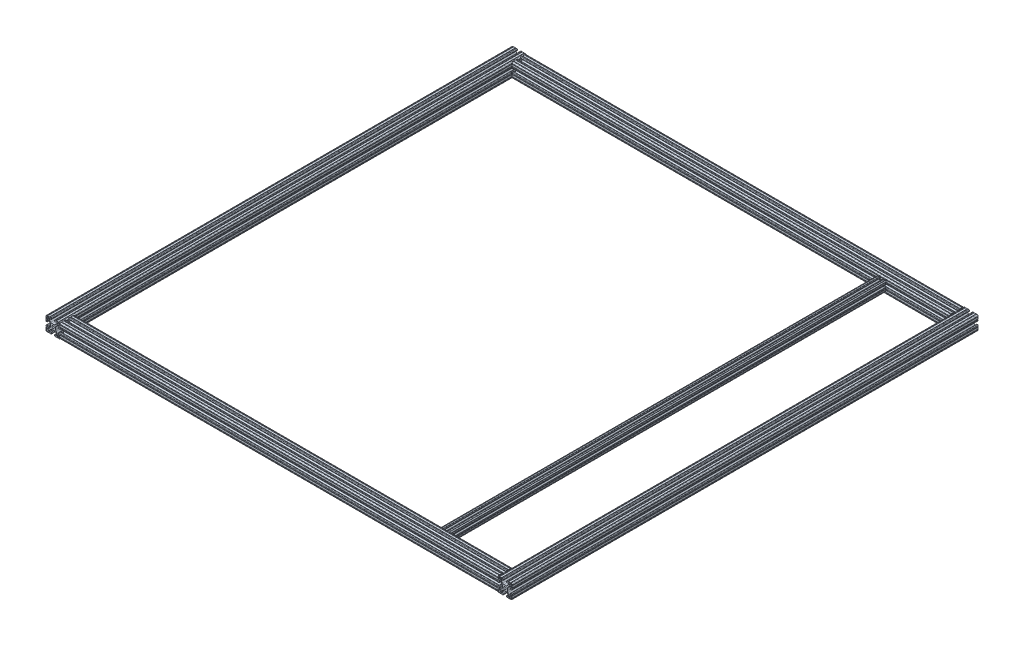
from build123d import *

# Parameters (mm, degrees)
STRUCTURAL_MEMBER1_DEPTH      = 1238.25
STRUCTURAL_MEMBER1_DEPTH_BACK = 19.05
SKETCH111_R                   = 3.3274
SKETCH111_ON_SEGMENT_2_R      = 3.3274
STRUCTURAL_MEMBER1_2_DEPTH    = 1257.3
SKETCH111_ON_SEGMENT_3_R      = 3.3274
STRUCTURAL_MEMBER1_3_DEPTH    = 1221.2
SKETCH111_ON_SEGMENT_4_R      = 3.3274
STRUCTURAL_MEMBER1_4_DEPTH    = 1221.2
SKETCH1_R                     = 2.6035
STRUCTURAL_MEMBER2_DEPTH      = 1219.2


with BuildPart() as part:
    # Sketch111 → Structural Member1 (new, two sides: drawn at the far end of the back side and taken through both)
    with BuildSketch(Plane(origin=(-609.6, 0, -609.6), x_dir=(1, 0, 0), z_dir=(0, 0, 1)).offset(-STRUCTURAL_MEMBER1_DEPTH_BACK)):
        with BuildLine():
            Line((-14.986, 6.858), (-15.8242, 6.858))
            Line((-15.8242, 6.858), (-15.8242, 9.017))
            ThreePointArc((-15.8242, 9.017), (-15.452225612, 9.915025612), (-14.5542, 10.287))
            Line((-14.5542, 10.287), (-12.810497326, 10.287))
            ThreePointArc((-12.810497326, 10.287), (-12.470291755, 10.219328904), (-12.181879398, 10.026617928))
            Line((-12.181879398, 10.026617928), (-8.249184211, 6.093922742))
            ThreePointArc((-8.249184211, 6.093922742), (-7.219556996, 4.552976719), (-6.858, 2.735306952))
            Line((-6.858, 2.735306952), (-6.858, -2.735306952))
            ThreePointArc((-6.858, -2.735306952), (-7.219556996, -4.552976719), (-8.249184211, -6.093922742))
            Line((-8.249184211, -6.093922742), (-12.181879398, -10.026617928))
            ThreePointArc((-12.181879398, -10.026617928), (-12.470291755, -10.219328904), (-12.810497326, -10.287))
            Line((-12.810497326, -10.287), (-14.5542, -10.287))
            ThreePointArc((-14.5542, -10.287), (-15.452225612, -9.915025612), (-15.8242, -9.017))
            Line((-15.8242, -9.017), (-15.8242, -6.858))
            Line((-15.8242, -6.858), (-14.986, -6.858))
            Line((-14.986, -6.858), (-14.986, -5.6388))
            ThreePointArc((-14.986, -5.6388), (-15.447248241, -4.525248241), (-16.5608, -4.064))
            Line((-16.5608, -4.064), (-17.4752, -4.064))
            ThreePointArc((-17.4752, -4.064), (-18.588751759, -4.525248241), (-19.05, -5.6388))
            Line((-19.05, -5.6388), (-19.05, -7.9756))
            ThreePointArc((-19.05, -7.9756), (-18.288, -8.7376), (-19.05, -9.4996))
            Line((-19.05, -9.4996), (-19.05, -14.3256))
            ThreePointArc((-19.05, -14.3256), (-18.288, -15.0876), (-19.05, -15.8496))
            Line((-19.05, -15.8496), (-19.05, -16.256))
            ThreePointArc((-19.05, -16.256), (-18.231656347, -18.231656347), (-16.256, -19.05))
            Line((-16.256, -19.05), (-15.8496, -19.05))
            ThreePointArc((-15.8496, -19.05), (-15.0876, -18.288), (-14.3256, -19.05))
            Line((-14.3256, -19.05), (-9.4996, -19.05))
            ThreePointArc((-9.4996, -19.05), (-8.7376, -18.288), (-7.9756, -19.05))
            Line((-7.9756, -19.05), (-5.6388, -19.05))
            ThreePointArc((-5.6388, -19.05), (-4.525248241, -18.588751759), (-4.064, -17.4752))
            Line((-4.064, -17.4752), (-4.064, -16.5608))
            ThreePointArc((-4.064, -16.5608), (-4.525248241, -15.447248241), (-5.6388, -14.986))
            Line((-5.6388, -14.986), (-6.858, -14.986))
            Line((-6.858, -14.986), (-6.858, -15.8242))
            Line((-6.858, -15.8242), (-9.017, -15.8242))
            ThreePointArc((-9.017, -15.8242), (-9.915025612, -15.452225612), (-10.287, -14.5542))
            Line((-10.287, -14.5542), (-10.287, -12.810497326))
            ThreePointArc((-10.287, -12.810497326), (-10.219328904, -12.470291755), (-10.026617928, -12.181879398))
            Line((-10.026617928, -12.181879398), (-6.093922742, -8.249184211))
            ThreePointArc((-6.093922742, -8.249184211), (-4.552976719, -7.219556996), (-2.735306952, -6.858))
            Line((-2.735306952, -6.858), (2.735306952, -6.858))
            ThreePointArc((2.735306952, -6.858), (4.552976719, -7.219556996), (6.093922742, -8.249184211))
            Line((6.093922742, -8.249184211), (10.026617928, -12.181879398))
            ThreePointArc((10.026617928, -12.181879398), (10.219328904, -12.470291755), (10.287, -12.810497326))
            Line((10.287, -12.810497326), (10.287, -14.5542))
            ThreePointArc((10.287, -14.5542), (9.915025612, -15.452225612), (9.017, -15.8242))
            Line((9.017, -15.8242), (6.858, -15.8242))
            Line((6.858, -15.8242), (6.858, -14.986))
            Line((6.858, -14.986), (5.6388, -14.986))
            ThreePointArc((5.6388, -14.986), (4.525248241, -15.447248241), (4.064, -16.5608))
            Line((4.064, -16.5608), (4.064, -17.4752))
            ThreePointArc((4.064, -17.4752), (4.525248241, -18.588751759), (5.6388, -19.05))
            Line((5.6388, -19.05), (7.9756, -19.05))
            ThreePointArc((7.9756, -19.05), (8.7376, -18.288), (9.4996, -19.05))
            Line((9.4996, -19.05), (14.3256, -19.05))
            ThreePointArc((14.3256, -19.05), (15.0876, -18.288), (15.8496, -19.05))
            Line((15.8496, -19.05), (16.256, -19.05))
            ThreePointArc((16.256, -19.05), (18.231656347, -18.231656347), (19.05, -16.256))
            Line((19.05, -16.256), (19.05, -15.8496))
            ThreePointArc((19.05, -15.8496), (18.288, -15.0876), (19.05, -14.3256))
            Line((19.05, -14.3256), (19.05, -9.4996))
            ThreePointArc((19.05, -9.4996), (18.288, -8.7376), (19.05, -7.9756))
            Line((19.05, -7.9756), (19.05, -5.6388))
            ThreePointArc((19.05, -5.6388), (18.588751759, -4.525248241), (17.4752, -4.064))
            Line((17.4752, -4.064), (16.5608, -4.064))
            ThreePointArc((16.5608, -4.064), (15.447248241, -4.525248241), (14.986, -5.6388))
            Line((14.986, -5.6388), (14.986, -6.858))
            Line((14.986, -6.858), (15.8242, -6.858))
            Line((15.8242, -6.858), (15.8242, -9.017))
            ThreePointArc((15.8242, -9.017), (15.452225612, -9.915025612), (14.5542, -10.287))
            Line((14.5542, -10.287), (12.810497326, -10.287))
            ThreePointArc((12.810497326, -10.287), (12.470291755, -10.219328904), (12.181879398, -10.026617928))
            Line((12.181879398, -10.026617928), (8.249184211, -6.093922742))
            ThreePointArc((8.249184211, -6.093922742), (7.219556996, -4.552976719), (6.858, -2.735306952))
            Line((6.858, -2.735306952), (6.858, 2.735306952))
            ThreePointArc((6.858, 2.735306952), (7.219556996, 4.552976719), (8.249184211, 6.093922742))
            Line((8.249184211, 6.093922742), (12.181879398, 10.026617928))
            ThreePointArc((12.181879398, 10.026617928), (12.470291755, 10.219328904), (12.810497326, 10.287))
            Line((12.810497326, 10.287), (14.5542, 10.287))
            ThreePointArc((14.5542, 10.287), (15.452225612, 9.915025612), (15.8242, 9.017))
            Line((15.8242, 9.017), (15.8242, 6.858))
            Line((15.8242, 6.858), (14.986, 6.858))
            Line((14.986, 6.858), (14.986, 5.6388))
            ThreePointArc((14.986, 5.6388), (15.447248241, 4.525248241), (16.5608, 4.064))
            Line((16.5608, 4.064), (17.4752, 4.064))
            ThreePointArc((17.4752, 4.064), (18.588751759, 4.525248241), (19.05, 5.6388))
            Line((19.05, 5.6388), (19.05, 7.9756))
            ThreePointArc((19.05, 7.9756), (18.288, 8.7376), (19.05, 9.4996))
            Line((19.05, 9.4996), (19.05, 14.3256))
            ThreePointArc((19.05, 14.3256), (18.288, 15.0876), (19.05, 15.8496))
            Line((19.05, 15.8496), (19.05, 16.256))
            ThreePointArc((19.05, 16.256), (18.231656347, 18.231656347), (16.256, 19.05))
            Line((16.256, 19.05), (15.8496, 19.05))
            ThreePointArc((15.8496, 19.05), (15.0876, 18.288), (14.3256, 19.05))
            Line((14.3256, 19.05), (9.4996, 19.05))
            ThreePointArc((9.4996, 19.05), (8.7376, 18.288), (7.9756, 19.05))
            Line((7.9756, 19.05), (5.6388, 19.05))
            ThreePointArc((5.6388, 19.05), (4.525248241, 18.588751759), (4.064, 17.4752))
            Line((4.064, 17.4752), (4.064, 16.5608))
            ThreePointArc((4.064, 16.5608), (4.525248241, 15.447248241), (5.6388, 14.986))
            Line((5.6388, 14.986), (6.858, 14.986))
            Line((6.858, 14.986), (6.858, 15.8242))
            Line((6.858, 15.8242), (9.017, 15.8242))
            ThreePointArc((9.017, 15.8242), (9.915025612, 15.452225612), (10.287, 14.5542))
            Line((10.287, 14.5542), (10.287, 12.810497326))
            ThreePointArc((10.287, 12.810497326), (10.219328904, 12.470291755), (10.026617928, 12.181879398))
            Line((10.026617928, 12.181879398), (6.093922742, 8.249184211))
            ThreePointArc((6.093922742, 8.249184211), (4.552976719, 7.219556996), (2.735306952, 6.858))
            Line((2.735306952, 6.858), (-2.735306952, 6.858))
            ThreePointArc((-2.735306952, 6.858), (-4.552976719, 7.219556996), (-6.093922742, 8.249184211))
            Line((-6.093922742, 8.249184211), (-10.026617928, 12.181879398))
            ThreePointArc((-10.026617928, 12.181879398), (-10.219328904, 12.470291755), (-10.287, 12.810497326))
            Line((-10.287, 12.810497326), (-10.287, 14.5542))
            ThreePointArc((-10.287, 14.5542), (-9.915025612, 15.452225612), (-9.017, 15.8242))
            Line((-9.017, 15.8242), (-6.858, 15.8242))
            Line((-6.858, 15.8242), (-6.858, 14.986))
            Line((-6.858, 14.986), (-5.6388, 14.986))
            ThreePointArc((-5.6388, 14.986), (-4.525248241, 15.447248241), (-4.064, 16.5608))
            Line((-4.064, 16.5608), (-4.064, 17.4752))
            ThreePointArc((-4.064, 17.4752), (-4.525248241, 18.588751759), (-5.6388, 19.05))
            Line((-5.6388, 19.05), (-7.9756, 19.05))
            ThreePointArc((-7.9756, 19.05), (-8.7376, 18.288), (-9.4996, 19.05))
            Line((-9.4996, 19.05), (-14.3256, 19.05))
            ThreePointArc((-14.3256, 19.05), (-15.0876, 18.288), (-15.8496, 19.05))
            Line((-15.8496, 19.05), (-16.256, 19.05))
            ThreePointArc((-16.256, 19.05), (-18.231656347, 18.231656347), (-19.05, 16.256))
            Line((-19.05, 16.256), (-19.05, 15.8496))
            ThreePointArc((-19.05, 15.8496), (-18.288, 15.0876), (-19.05, 14.3256))
            Line((-19.05, 14.3256), (-19.05, 9.4996))
            ThreePointArc((-19.05, 9.4996), (-18.288, 8.7376), (-19.05, 7.9756))
            Line((-19.05, 7.9756), (-19.05, 5.6388))
            ThreePointArc((-19.05, 5.6388), (-18.588751759, 4.525248241), (-17.4752, 4.064))
            Line((-17.4752, 4.064), (-16.5608, 4.064))
            ThreePointArc((-16.5608, 4.064), (-15.447248241, 4.525248241), (-14.986, 5.6388))
            Line((-14.986, 5.6388), (-14.986, 6.858))
        make_face()
        Circle(SKETCH111_R, mode=Mode.SUBTRACT)
        with BuildLine():
            Line((-11.8618, 16.8656), (-11.8618, 12.2428))
            ThreePointArc((-11.8618, 12.2428), (-11.973392316, 11.973392316), (-12.2428, 11.8618))
            Line((-12.2428, 11.8618), (-16.8656, 11.8618))
            ThreePointArc((-16.8656, 11.8618), (-17.135007684, 11.973392316), (-17.2466, 12.2428))
            Line((-17.2466, 12.2428), (-17.2466, 14.4526))
            ThreePointArc((-17.2466, 14.4526), (-16.428256347, 16.428256347), (-14.4526, 17.2466))
            Line((-14.4526, 17.2466), (-12.2428, 17.2466))
            ThreePointArc((-12.2428, 17.2466), (-11.973392316, 17.135007684), (-11.8618, 16.8656))
        make_face(mode=Mode.SUBTRACT)
        with BuildLine():
            Line((-16.8656, -11.8618), (-12.2428, -11.8618))
            ThreePointArc((-12.2428, -11.8618), (-11.973392316, -11.973392316), (-11.8618, -12.2428))
            Line((-11.8618, -12.2428), (-11.8618, -16.8656))
            ThreePointArc((-11.8618, -16.8656), (-11.973392316, -17.135007684), (-12.2428, -17.2466))
            Line((-12.2428, -17.2466), (-14.4526, -17.2466))
            ThreePointArc((-14.4526, -17.2466), (-16.428256347, -16.428256347), (-17.2466, -14.4526))
            Line((-17.2466, -14.4526), (-17.2466, -12.2428))
            ThreePointArc((-17.2466, -12.2428), (-17.135007684, -11.973392316), (-16.8656, -11.8618))
        make_face(mode=Mode.SUBTRACT)
        with BuildLine():
            Line((11.8618, -16.8656), (11.8618, -12.2428))
            ThreePointArc((11.8618, -12.2428), (11.973392316, -11.973392316), (12.2428, -11.8618))
            Line((12.2428, -11.8618), (16.8656, -11.8618))
            ThreePointArc((16.8656, -11.8618), (17.135007684, -11.973392316), (17.2466, -12.2428))
            Line((17.2466, -12.2428), (17.2466, -14.4526))
            ThreePointArc((17.2466, -14.4526), (16.428256347, -16.428256347), (14.4526, -17.2466))
            Line((14.4526, -17.2466), (12.2428, -17.2466))
            ThreePointArc((12.2428, -17.2466), (11.973392316, -17.135007684), (11.8618, -16.8656))
        make_face(mode=Mode.SUBTRACT)
        with BuildLine():
            Line((11.8618, 12.2428), (11.8618, 16.8656))
            ThreePointArc((11.8618, 16.8656), (11.973392316, 17.135007684), (12.2428, 17.2466))
            Line((12.2428, 17.2466), (14.4526, 17.2466))
            ThreePointArc((14.4526, 17.2466), (16.428256347, 16.428256347), (17.2466, 14.4526))
            Line((17.2466, 14.4526), (17.2466, 12.2428))
            ThreePointArc((17.2466, 12.2428), (17.135007684, 11.973392316), (16.8656, 11.8618))
            Line((16.8656, 11.8618), (12.2428, 11.8618))
            ThreePointArc((12.2428, 11.8618), (11.973392316, 11.973392316), (11.8618, 12.2428))
        make_face(mode=Mode.SUBTRACT)
    extrude(amount=STRUCTURAL_MEMBER1_DEPTH + STRUCTURAL_MEMBER1_DEPTH_BACK)


with BuildPart() as body_2:
    # Sketch111 on segment 2 (carried to segment 2) → Structural Member1 2 (new body)
    with BuildSketch(Plane(origin=(609.6, 0, -628.65), x_dir=(1, 0, 0), z_dir=(0, 0, 1))):
        with BuildLine():
            Line((-14.986, 6.858), (-15.8242, 6.858))
            Line((-15.8242, 6.858), (-15.8242, 9.017))
            ThreePointArc((-15.8242, 9.017), (-15.452225612, 9.915025612), (-14.5542, 10.287))
            Line((-14.5542, 10.287), (-12.810497326, 10.287))
            ThreePointArc((-12.810497326, 10.287), (-12.470291755, 10.219328904), (-12.181879398, 10.026617928))
            Line((-12.181879398, 10.026617928), (-8.249184211, 6.093922742))
            ThreePointArc((-8.249184211, 6.093922742), (-7.219556996, 4.552976719), (-6.858, 2.735306952))
            Line((-6.858, 2.735306952), (-6.858, -2.735306952))
            ThreePointArc((-6.858, -2.735306952), (-7.219556996, -4.552976719), (-8.249184211, -6.093922742))
            Line((-8.249184211, -6.093922742), (-12.181879398, -10.026617928))
            ThreePointArc((-12.181879398, -10.026617928), (-12.470291755, -10.219328904), (-12.810497326, -10.287))
            Line((-12.810497326, -10.287), (-14.5542, -10.287))
            ThreePointArc((-14.5542, -10.287), (-15.452225612, -9.915025612), (-15.8242, -9.017))
            Line((-15.8242, -9.017), (-15.8242, -6.858))
            Line((-15.8242, -6.858), (-14.986, -6.858))
            Line((-14.986, -6.858), (-14.986, -5.6388))
            ThreePointArc((-14.986, -5.6388), (-15.447248241, -4.525248241), (-16.5608, -4.064))
            Line((-16.5608, -4.064), (-17.4752, -4.064))
            ThreePointArc((-17.4752, -4.064), (-18.588751759, -4.525248241), (-19.05, -5.6388))
            Line((-19.05, -5.6388), (-19.05, -7.9756))
            ThreePointArc((-19.05, -7.9756), (-18.288, -8.7376), (-19.05, -9.4996))
            Line((-19.05, -9.4996), (-19.05, -14.3256))
            ThreePointArc((-19.05, -14.3256), (-18.288, -15.0876), (-19.05, -15.8496))
            Line((-19.05, -15.8496), (-19.05, -16.256))
            ThreePointArc((-19.05, -16.256), (-18.231656347, -18.231656347), (-16.256, -19.05))
            Line((-16.256, -19.05), (-15.8496, -19.05))
            ThreePointArc((-15.8496, -19.05), (-15.0876, -18.288), (-14.3256, -19.05))
            Line((-14.3256, -19.05), (-9.4996, -19.05))
            ThreePointArc((-9.4996, -19.05), (-8.7376, -18.288), (-7.9756, -19.05))
            Line((-7.9756, -19.05), (-5.6388, -19.05))
            ThreePointArc((-5.6388, -19.05), (-4.525248241, -18.588751759), (-4.064, -17.4752))
            Line((-4.064, -17.4752), (-4.064, -16.5608))
            ThreePointArc((-4.064, -16.5608), (-4.525248241, -15.447248241), (-5.6388, -14.986))
            Line((-5.6388, -14.986), (-6.858, -14.986))
            Line((-6.858, -14.986), (-6.858, -15.8242))
            Line((-6.858, -15.8242), (-9.017, -15.8242))
            ThreePointArc((-9.017, -15.8242), (-9.915025612, -15.452225612), (-10.287, -14.5542))
            Line((-10.287, -14.5542), (-10.287, -12.810497326))
            ThreePointArc((-10.287, -12.810497326), (-10.219328904, -12.470291755), (-10.026617928, -12.181879398))
            Line((-10.026617928, -12.181879398), (-6.093922742, -8.249184211))
            ThreePointArc((-6.093922742, -8.249184211), (-4.552976719, -7.219556996), (-2.735306952, -6.858))
            Line((-2.735306952, -6.858), (2.735306952, -6.858))
            ThreePointArc((2.735306952, -6.858), (4.552976719, -7.219556996), (6.093922742, -8.249184211))
            Line((6.093922742, -8.249184211), (10.026617928, -12.181879398))
            ThreePointArc((10.026617928, -12.181879398), (10.219328904, -12.470291755), (10.287, -12.810497326))
            Line((10.287, -12.810497326), (10.287, -14.5542))
            ThreePointArc((10.287, -14.5542), (9.915025612, -15.452225612), (9.017, -15.8242))
            Line((9.017, -15.8242), (6.858, -15.8242))
            Line((6.858, -15.8242), (6.858, -14.986))
            Line((6.858, -14.986), (5.6388, -14.986))
            ThreePointArc((5.6388, -14.986), (4.525248241, -15.447248241), (4.064, -16.5608))
            Line((4.064, -16.5608), (4.064, -17.4752))
            ThreePointArc((4.064, -17.4752), (4.525248241, -18.588751759), (5.6388, -19.05))
            Line((5.6388, -19.05), (7.9756, -19.05))
            ThreePointArc((7.9756, -19.05), (8.7376, -18.288), (9.4996, -19.05))
            Line((9.4996, -19.05), (14.3256, -19.05))
            ThreePointArc((14.3256, -19.05), (15.0876, -18.288), (15.8496, -19.05))
            Line((15.8496, -19.05), (16.256, -19.05))
            ThreePointArc((16.256, -19.05), (18.231656347, -18.231656347), (19.05, -16.256))
            Line((19.05, -16.256), (19.05, -15.8496))
            ThreePointArc((19.05, -15.8496), (18.288, -15.0876), (19.05, -14.3256))
            Line((19.05, -14.3256), (19.05, -9.4996))
            ThreePointArc((19.05, -9.4996), (18.288, -8.7376), (19.05, -7.9756))
            Line((19.05, -7.9756), (19.05, -5.6388))
            ThreePointArc((19.05, -5.6388), (18.588751759, -4.525248241), (17.4752, -4.064))
            Line((17.4752, -4.064), (16.5608, -4.064))
            ThreePointArc((16.5608, -4.064), (15.447248241, -4.525248241), (14.986, -5.6388))
            Line((14.986, -5.6388), (14.986, -6.858))
            Line((14.986, -6.858), (15.8242, -6.858))
            Line((15.8242, -6.858), (15.8242, -9.017))
            ThreePointArc((15.8242, -9.017), (15.452225612, -9.915025612), (14.5542, -10.287))
            Line((14.5542, -10.287), (12.810497326, -10.287))
            ThreePointArc((12.810497326, -10.287), (12.470291755, -10.219328904), (12.181879398, -10.026617928))
            Line((12.181879398, -10.026617928), (8.249184211, -6.093922742))
            ThreePointArc((8.249184211, -6.093922742), (7.219556996, -4.552976719), (6.858, -2.735306952))
            Line((6.858, -2.735306952), (6.858, 2.735306952))
            ThreePointArc((6.858, 2.735306952), (7.219556996, 4.552976719), (8.249184211, 6.093922742))
            Line((8.249184211, 6.093922742), (12.181879398, 10.026617928))
            ThreePointArc((12.181879398, 10.026617928), (12.470291755, 10.219328904), (12.810497326, 10.287))
            Line((12.810497326, 10.287), (14.5542, 10.287))
            ThreePointArc((14.5542, 10.287), (15.452225612, 9.915025612), (15.8242, 9.017))
            Line((15.8242, 9.017), (15.8242, 6.858))
            Line((15.8242, 6.858), (14.986, 6.858))
            Line((14.986, 6.858), (14.986, 5.6388))
            ThreePointArc((14.986, 5.6388), (15.447248241, 4.525248241), (16.5608, 4.064))
            Line((16.5608, 4.064), (17.4752, 4.064))
            ThreePointArc((17.4752, 4.064), (18.588751759, 4.525248241), (19.05, 5.6388))
            Line((19.05, 5.6388), (19.05, 7.9756))
            ThreePointArc((19.05, 7.9756), (18.288, 8.7376), (19.05, 9.4996))
            Line((19.05, 9.4996), (19.05, 14.3256))
            ThreePointArc((19.05, 14.3256), (18.288, 15.0876), (19.05, 15.8496))
            Line((19.05, 15.8496), (19.05, 16.256))
            ThreePointArc((19.05, 16.256), (18.231656347, 18.231656347), (16.256, 19.05))
            Line((16.256, 19.05), (15.8496, 19.05))
            ThreePointArc((15.8496, 19.05), (15.0876, 18.288), (14.3256, 19.05))
            Line((14.3256, 19.05), (9.4996, 19.05))
            ThreePointArc((9.4996, 19.05), (8.7376, 18.288), (7.9756, 19.05))
            Line((7.9756, 19.05), (5.6388, 19.05))
            ThreePointArc((5.6388, 19.05), (4.525248241, 18.588751759), (4.064, 17.4752))
            Line((4.064, 17.4752), (4.064, 16.5608))
            ThreePointArc((4.064, 16.5608), (4.525248241, 15.447248241), (5.6388, 14.986))
            Line((5.6388, 14.986), (6.858, 14.986))
            Line((6.858, 14.986), (6.858, 15.8242))
            Line((6.858, 15.8242), (9.017, 15.8242))
            ThreePointArc((9.017, 15.8242), (9.915025612, 15.452225612), (10.287, 14.5542))
            Line((10.287, 14.5542), (10.287, 12.810497326))
            ThreePointArc((10.287, 12.810497326), (10.219328904, 12.470291755), (10.026617928, 12.181879398))
            Line((10.026617928, 12.181879398), (6.093922742, 8.249184211))
            ThreePointArc((6.093922742, 8.249184211), (4.552976719, 7.219556996), (2.735306952, 6.858))
            Line((2.735306952, 6.858), (-2.735306952, 6.858))
            ThreePointArc((-2.735306952, 6.858), (-4.552976719, 7.219556996), (-6.093922742, 8.249184211))
            Line((-6.093922742, 8.249184211), (-10.026617928, 12.181879398))
            ThreePointArc((-10.026617928, 12.181879398), (-10.219328904, 12.470291755), (-10.287, 12.810497326))
            Line((-10.287, 12.810497326), (-10.287, 14.5542))
            ThreePointArc((-10.287, 14.5542), (-9.915025612, 15.452225612), (-9.017, 15.8242))
            Line((-9.017, 15.8242), (-6.858, 15.8242))
            Line((-6.858, 15.8242), (-6.858, 14.986))
            Line((-6.858, 14.986), (-5.6388, 14.986))
            ThreePointArc((-5.6388, 14.986), (-4.525248241, 15.447248241), (-4.064, 16.5608))
            Line((-4.064, 16.5608), (-4.064, 17.4752))
            ThreePointArc((-4.064, 17.4752), (-4.525248241, 18.588751759), (-5.6388, 19.05))
            Line((-5.6388, 19.05), (-7.9756, 19.05))
            ThreePointArc((-7.9756, 19.05), (-8.7376, 18.288), (-9.4996, 19.05))
            Line((-9.4996, 19.05), (-14.3256, 19.05))
            ThreePointArc((-14.3256, 19.05), (-15.0876, 18.288), (-15.8496, 19.05))
            Line((-15.8496, 19.05), (-16.256, 19.05))
            ThreePointArc((-16.256, 19.05), (-18.231656347, 18.231656347), (-19.05, 16.256))
            Line((-19.05, 16.256), (-19.05, 15.8496))
            ThreePointArc((-19.05, 15.8496), (-18.288, 15.0876), (-19.05, 14.3256))
            Line((-19.05, 14.3256), (-19.05, 9.4996))
            ThreePointArc((-19.05, 9.4996), (-18.288, 8.7376), (-19.05, 7.9756))
            Line((-19.05, 7.9756), (-19.05, 5.6388))
            ThreePointArc((-19.05, 5.6388), (-18.588751759, 4.525248241), (-17.4752, 4.064))
            Line((-17.4752, 4.064), (-16.5608, 4.064))
            ThreePointArc((-16.5608, 4.064), (-15.447248241, 4.525248241), (-14.986, 5.6388))
            Line((-14.986, 5.6388), (-14.986, 6.858))
        make_face()
        Circle(SKETCH111_ON_SEGMENT_2_R, mode=Mode.SUBTRACT)
        with BuildLine():
            Line((-11.8618, 16.8656), (-11.8618, 12.2428))
            ThreePointArc((-11.8618, 12.2428), (-11.973392316, 11.973392316), (-12.2428, 11.8618))
            Line((-12.2428, 11.8618), (-16.8656, 11.8618))
            ThreePointArc((-16.8656, 11.8618), (-17.135007684, 11.973392316), (-17.2466, 12.2428))
            Line((-17.2466, 12.2428), (-17.2466, 14.4526))
            ThreePointArc((-17.2466, 14.4526), (-16.428256347, 16.428256347), (-14.4526, 17.2466))
            Line((-14.4526, 17.2466), (-12.2428, 17.2466))
            ThreePointArc((-12.2428, 17.2466), (-11.973392316, 17.135007684), (-11.8618, 16.8656))
        make_face(mode=Mode.SUBTRACT)
        with BuildLine():
            Line((-16.8656, -11.8618), (-12.2428, -11.8618))
            ThreePointArc((-12.2428, -11.8618), (-11.973392316, -11.973392316), (-11.8618, -12.2428))
            Line((-11.8618, -12.2428), (-11.8618, -16.8656))
            ThreePointArc((-11.8618, -16.8656), (-11.973392316, -17.135007684), (-12.2428, -17.2466))
            Line((-12.2428, -17.2466), (-14.4526, -17.2466))
            ThreePointArc((-14.4526, -17.2466), (-16.428256347, -16.428256347), (-17.2466, -14.4526))
            Line((-17.2466, -14.4526), (-17.2466, -12.2428))
            ThreePointArc((-17.2466, -12.2428), (-17.135007684, -11.973392316), (-16.8656, -11.8618))
        make_face(mode=Mode.SUBTRACT)
        with BuildLine():
            Line((11.8618, -16.8656), (11.8618, -12.2428))
            ThreePointArc((11.8618, -12.2428), (11.973392316, -11.973392316), (12.2428, -11.8618))
            Line((12.2428, -11.8618), (16.8656, -11.8618))
            ThreePointArc((16.8656, -11.8618), (17.135007684, -11.973392316), (17.2466, -12.2428))
            Line((17.2466, -12.2428), (17.2466, -14.4526))
            ThreePointArc((17.2466, -14.4526), (16.428256347, -16.428256347), (14.4526, -17.2466))
            Line((14.4526, -17.2466), (12.2428, -17.2466))
            ThreePointArc((12.2428, -17.2466), (11.973392316, -17.135007684), (11.8618, -16.8656))
        make_face(mode=Mode.SUBTRACT)
        with BuildLine():
            Line((11.8618, 12.2428), (11.8618, 16.8656))
            ThreePointArc((11.8618, 16.8656), (11.973392316, 17.135007684), (12.2428, 17.2466))
            Line((12.2428, 17.2466), (14.4526, 17.2466))
            ThreePointArc((14.4526, 17.2466), (16.428256347, 16.428256347), (17.2466, 14.4526))
            Line((17.2466, 14.4526), (17.2466, 12.2428))
            ThreePointArc((17.2466, 12.2428), (17.135007684, 11.973392316), (16.8656, 11.8618))
            Line((16.8656, 11.8618), (12.2428, 11.8618))
            ThreePointArc((12.2428, 11.8618), (11.973392316, 11.973392316), (11.8618, 12.2428))
        make_face(mode=Mode.SUBTRACT)
    extrude(amount=STRUCTURAL_MEMBER1_2_DEPTH)


with BuildPart() as body_3:
    # Sketch111 on segment 3 (carried to segment 3) → Structural Member1 3 (new body)
    with BuildSketch(Plane(origin=(-610.6, 0, 609.6), x_dir=(0, 0, -1), z_dir=(1, 0, 0))):
        with BuildLine():
            Line((-14.986, 6.858), (-15.8242, 6.858))
            Line((-15.8242, 6.858), (-15.8242, 9.017))
            ThreePointArc((-15.8242, 9.017), (-15.452225612, 9.915025612), (-14.5542, 10.287))
            Line((-14.5542, 10.287), (-12.810497326, 10.287))
            ThreePointArc((-12.810497326, 10.287), (-12.470291755, 10.219328904), (-12.181879398, 10.026617928))
            Line((-12.181879398, 10.026617928), (-8.249184211, 6.093922742))
            ThreePointArc((-8.249184211, 6.093922742), (-7.219556996, 4.552976719), (-6.858, 2.735306952))
            Line((-6.858, 2.735306952), (-6.858, -2.735306952))
            ThreePointArc((-6.858, -2.735306952), (-7.219556996, -4.552976719), (-8.249184211, -6.093922742))
            Line((-8.249184211, -6.093922742), (-12.181879398, -10.026617928))
            ThreePointArc((-12.181879398, -10.026617928), (-12.470291755, -10.219328904), (-12.810497326, -10.287))
            Line((-12.810497326, -10.287), (-14.5542, -10.287))
            ThreePointArc((-14.5542, -10.287), (-15.452225612, -9.915025612), (-15.8242, -9.017))
            Line((-15.8242, -9.017), (-15.8242, -6.858))
            Line((-15.8242, -6.858), (-14.986, -6.858))
            Line((-14.986, -6.858), (-14.986, -5.6388))
            ThreePointArc((-14.986, -5.6388), (-15.447248241, -4.525248241), (-16.5608, -4.064))
            Line((-16.5608, -4.064), (-17.4752, -4.064))
            ThreePointArc((-17.4752, -4.064), (-18.588751759, -4.525248241), (-19.05, -5.6388))
            Line((-19.05, -5.6388), (-19.05, -7.9756))
            ThreePointArc((-19.05, -7.9756), (-18.288, -8.7376), (-19.05, -9.4996))
            Line((-19.05, -9.4996), (-19.05, -14.3256))
            ThreePointArc((-19.05, -14.3256), (-18.288, -15.0876), (-19.05, -15.8496))
            Line((-19.05, -15.8496), (-19.05, -16.256))
            ThreePointArc((-19.05, -16.256), (-18.231656347, -18.231656347), (-16.256, -19.05))
            Line((-16.256, -19.05), (-15.8496, -19.05))
            ThreePointArc((-15.8496, -19.05), (-15.0876, -18.288), (-14.3256, -19.05))
            Line((-14.3256, -19.05), (-9.4996, -19.05))
            ThreePointArc((-9.4996, -19.05), (-8.7376, -18.288), (-7.9756, -19.05))
            Line((-7.9756, -19.05), (-5.6388, -19.05))
            ThreePointArc((-5.6388, -19.05), (-4.525248241, -18.588751759), (-4.064, -17.4752))
            Line((-4.064, -17.4752), (-4.064, -16.5608))
            ThreePointArc((-4.064, -16.5608), (-4.525248241, -15.447248241), (-5.6388, -14.986))
            Line((-5.6388, -14.986), (-6.858, -14.986))
            Line((-6.858, -14.986), (-6.858, -15.8242))
            Line((-6.858, -15.8242), (-9.017, -15.8242))
            ThreePointArc((-9.017, -15.8242), (-9.915025612, -15.452225612), (-10.287, -14.5542))
            Line((-10.287, -14.5542), (-10.287, -12.810497326))
            ThreePointArc((-10.287, -12.810497326), (-10.219328904, -12.470291755), (-10.026617928, -12.181879398))
            Line((-10.026617928, -12.181879398), (-6.093922742, -8.249184211))
            ThreePointArc((-6.093922742, -8.249184211), (-4.552976719, -7.219556996), (-2.735306952, -6.858))
            Line((-2.735306952, -6.858), (2.735306952, -6.858))
            ThreePointArc((2.735306952, -6.858), (4.552976719, -7.219556996), (6.093922742, -8.249184211))
            Line((6.093922742, -8.249184211), (10.026617928, -12.181879398))
            ThreePointArc((10.026617928, -12.181879398), (10.219328904, -12.470291755), (10.287, -12.810497326))
            Line((10.287, -12.810497326), (10.287, -14.5542))
            ThreePointArc((10.287, -14.5542), (9.915025612, -15.452225612), (9.017, -15.8242))
            Line((9.017, -15.8242), (6.858, -15.8242))
            Line((6.858, -15.8242), (6.858, -14.986))
            Line((6.858, -14.986), (5.6388, -14.986))
            ThreePointArc((5.6388, -14.986), (4.525248241, -15.447248241), (4.064, -16.5608))
            Line((4.064, -16.5608), (4.064, -17.4752))
            ThreePointArc((4.064, -17.4752), (4.525248241, -18.588751759), (5.6388, -19.05))
            Line((5.6388, -19.05), (7.9756, -19.05))
            ThreePointArc((7.9756, -19.05), (8.7376, -18.288), (9.4996, -19.05))
            Line((9.4996, -19.05), (14.3256, -19.05))
            ThreePointArc((14.3256, -19.05), (15.0876, -18.288), (15.8496, -19.05))
            Line((15.8496, -19.05), (16.256, -19.05))
            ThreePointArc((16.256, -19.05), (18.231656347, -18.231656347), (19.05, -16.256))
            Line((19.05, -16.256), (19.05, -15.8496))
            ThreePointArc((19.05, -15.8496), (18.288, -15.0876), (19.05, -14.3256))
            Line((19.05, -14.3256), (19.05, -9.4996))
            ThreePointArc((19.05, -9.4996), (18.288, -8.7376), (19.05, -7.9756))
            Line((19.05, -7.9756), (19.05, -5.6388))
            ThreePointArc((19.05, -5.6388), (18.588751759, -4.525248241), (17.4752, -4.064))
            Line((17.4752, -4.064), (16.5608, -4.064))
            ThreePointArc((16.5608, -4.064), (15.447248241, -4.525248241), (14.986, -5.6388))
            Line((14.986, -5.6388), (14.986, -6.858))
            Line((14.986, -6.858), (15.8242, -6.858))
            Line((15.8242, -6.858), (15.8242, -9.017))
            ThreePointArc((15.8242, -9.017), (15.452225612, -9.915025612), (14.5542, -10.287))
            Line((14.5542, -10.287), (12.810497326, -10.287))
            ThreePointArc((12.810497326, -10.287), (12.470291755, -10.219328904), (12.181879398, -10.026617928))
            Line((12.181879398, -10.026617928), (8.249184211, -6.093922742))
            ThreePointArc((8.249184211, -6.093922742), (7.219556996, -4.552976719), (6.858, -2.735306952))
            Line((6.858, -2.735306952), (6.858, 2.735306952))
            ThreePointArc((6.858, 2.735306952), (7.219556996, 4.552976719), (8.249184211, 6.093922742))
            Line((8.249184211, 6.093922742), (12.181879398, 10.026617928))
            ThreePointArc((12.181879398, 10.026617928), (12.470291755, 10.219328904), (12.810497326, 10.287))
            Line((12.810497326, 10.287), (14.5542, 10.287))
            ThreePointArc((14.5542, 10.287), (15.452225612, 9.915025612), (15.8242, 9.017))
            Line((15.8242, 9.017), (15.8242, 6.858))
            Line((15.8242, 6.858), (14.986, 6.858))
            Line((14.986, 6.858), (14.986, 5.6388))
            ThreePointArc((14.986, 5.6388), (15.447248241, 4.525248241), (16.5608, 4.064))
            Line((16.5608, 4.064), (17.4752, 4.064))
            ThreePointArc((17.4752, 4.064), (18.588751759, 4.525248241), (19.05, 5.6388))
            Line((19.05, 5.6388), (19.05, 7.9756))
            ThreePointArc((19.05, 7.9756), (18.288, 8.7376), (19.05, 9.4996))
            Line((19.05, 9.4996), (19.05, 14.3256))
            ThreePointArc((19.05, 14.3256), (18.288, 15.0876), (19.05, 15.8496))
            Line((19.05, 15.8496), (19.05, 16.256))
            ThreePointArc((19.05, 16.256), (18.231656347, 18.231656347), (16.256, 19.05))
            Line((16.256, 19.05), (15.8496, 19.05))
            ThreePointArc((15.8496, 19.05), (15.0876, 18.288), (14.3256, 19.05))
            Line((14.3256, 19.05), (9.4996, 19.05))
            ThreePointArc((9.4996, 19.05), (8.7376, 18.288), (7.9756, 19.05))
            Line((7.9756, 19.05), (5.6388, 19.05))
            ThreePointArc((5.6388, 19.05), (4.525248241, 18.588751759), (4.064, 17.4752))
            Line((4.064, 17.4752), (4.064, 16.5608))
            ThreePointArc((4.064, 16.5608), (4.525248241, 15.447248241), (5.6388, 14.986))
            Line((5.6388, 14.986), (6.858, 14.986))
            Line((6.858, 14.986), (6.858, 15.8242))
            Line((6.858, 15.8242), (9.017, 15.8242))
            ThreePointArc((9.017, 15.8242), (9.915025612, 15.452225612), (10.287, 14.5542))
            Line((10.287, 14.5542), (10.287, 12.810497326))
            ThreePointArc((10.287, 12.810497326), (10.219328904, 12.470291755), (10.026617928, 12.181879398))
            Line((10.026617928, 12.181879398), (6.093922742, 8.249184211))
            ThreePointArc((6.093922742, 8.249184211), (4.552976719, 7.219556996), (2.735306952, 6.858))
            Line((2.735306952, 6.858), (-2.735306952, 6.858))
            ThreePointArc((-2.735306952, 6.858), (-4.552976719, 7.219556996), (-6.093922742, 8.249184211))
            Line((-6.093922742, 8.249184211), (-10.026617928, 12.181879398))
            ThreePointArc((-10.026617928, 12.181879398), (-10.219328904, 12.470291755), (-10.287, 12.810497326))
            Line((-10.287, 12.810497326), (-10.287, 14.5542))
            ThreePointArc((-10.287, 14.5542), (-9.915025612, 15.452225612), (-9.017, 15.8242))
            Line((-9.017, 15.8242), (-6.858, 15.8242))
            Line((-6.858, 15.8242), (-6.858, 14.986))
            Line((-6.858, 14.986), (-5.6388, 14.986))
            ThreePointArc((-5.6388, 14.986), (-4.525248241, 15.447248241), (-4.064, 16.5608))
            Line((-4.064, 16.5608), (-4.064, 17.4752))
            ThreePointArc((-4.064, 17.4752), (-4.525248241, 18.588751759), (-5.6388, 19.05))
            Line((-5.6388, 19.05), (-7.9756, 19.05))
            ThreePointArc((-7.9756, 19.05), (-8.7376, 18.288), (-9.4996, 19.05))
            Line((-9.4996, 19.05), (-14.3256, 19.05))
            ThreePointArc((-14.3256, 19.05), (-15.0876, 18.288), (-15.8496, 19.05))
            Line((-15.8496, 19.05), (-16.256, 19.05))
            ThreePointArc((-16.256, 19.05), (-18.231656347, 18.231656347), (-19.05, 16.256))
            Line((-19.05, 16.256), (-19.05, 15.8496))
            ThreePointArc((-19.05, 15.8496), (-18.288, 15.0876), (-19.05, 14.3256))
            Line((-19.05, 14.3256), (-19.05, 9.4996))
            ThreePointArc((-19.05, 9.4996), (-18.288, 8.7376), (-19.05, 7.9756))
            Line((-19.05, 7.9756), (-19.05, 5.6388))
            ThreePointArc((-19.05, 5.6388), (-18.588751759, 4.525248241), (-17.4752, 4.064))
            Line((-17.4752, 4.064), (-16.5608, 4.064))
            ThreePointArc((-16.5608, 4.064), (-15.447248241, 4.525248241), (-14.986, 5.6388))
            Line((-14.986, 5.6388), (-14.986, 6.858))
        make_face()
        Circle(SKETCH111_ON_SEGMENT_3_R, mode=Mode.SUBTRACT)
        with BuildLine():
            Line((-11.8618, 16.8656), (-11.8618, 12.2428))
            ThreePointArc((-11.8618, 12.2428), (-11.973392316, 11.973392316), (-12.2428, 11.8618))
            Line((-12.2428, 11.8618), (-16.8656, 11.8618))
            ThreePointArc((-16.8656, 11.8618), (-17.135007684, 11.973392316), (-17.2466, 12.2428))
            Line((-17.2466, 12.2428), (-17.2466, 14.4526))
            ThreePointArc((-17.2466, 14.4526), (-16.428256347, 16.428256347), (-14.4526, 17.2466))
            Line((-14.4526, 17.2466), (-12.2428, 17.2466))
            ThreePointArc((-12.2428, 17.2466), (-11.973392316, 17.135007684), (-11.8618, 16.8656))
        make_face(mode=Mode.SUBTRACT)
        with BuildLine():
            Line((-16.8656, -11.8618), (-12.2428, -11.8618))
            ThreePointArc((-12.2428, -11.8618), (-11.973392316, -11.973392316), (-11.8618, -12.2428))
            Line((-11.8618, -12.2428), (-11.8618, -16.8656))
            ThreePointArc((-11.8618, -16.8656), (-11.973392316, -17.135007684), (-12.2428, -17.2466))
            Line((-12.2428, -17.2466), (-14.4526, -17.2466))
            ThreePointArc((-14.4526, -17.2466), (-16.428256347, -16.428256347), (-17.2466, -14.4526))
            Line((-17.2466, -14.4526), (-17.2466, -12.2428))
            ThreePointArc((-17.2466, -12.2428), (-17.135007684, -11.973392316), (-16.8656, -11.8618))
        make_face(mode=Mode.SUBTRACT)
        with BuildLine():
            Line((11.8618, -16.8656), (11.8618, -12.2428))
            ThreePointArc((11.8618, -12.2428), (11.973392316, -11.973392316), (12.2428, -11.8618))
            Line((12.2428, -11.8618), (16.8656, -11.8618))
            ThreePointArc((16.8656, -11.8618), (17.135007684, -11.973392316), (17.2466, -12.2428))
            Line((17.2466, -12.2428), (17.2466, -14.4526))
            ThreePointArc((17.2466, -14.4526), (16.428256347, -16.428256347), (14.4526, -17.2466))
            Line((14.4526, -17.2466), (12.2428, -17.2466))
            ThreePointArc((12.2428, -17.2466), (11.973392316, -17.135007684), (11.8618, -16.8656))
        make_face(mode=Mode.SUBTRACT)
        with BuildLine():
            Line((11.8618, 12.2428), (11.8618, 16.8656))
            ThreePointArc((11.8618, 16.8656), (11.973392316, 17.135007684), (12.2428, 17.2466))
            Line((12.2428, 17.2466), (14.4526, 17.2466))
            ThreePointArc((14.4526, 17.2466), (16.428256347, 16.428256347), (17.2466, 14.4526))
            Line((17.2466, 14.4526), (17.2466, 12.2428))
            ThreePointArc((17.2466, 12.2428), (17.135007684, 11.973392316), (16.8656, 11.8618))
            Line((16.8656, 11.8618), (12.2428, 11.8618))
            ThreePointArc((12.2428, 11.8618), (11.973392316, 11.973392316), (11.8618, 12.2428))
        make_face(mode=Mode.SUBTRACT)
    extrude(amount=STRUCTURAL_MEMBER1_3_DEPTH)

    # Structural Member1 3 end butt 1
    split(bisect_by=Plane(origin=(-590.55, 0, 609.6), x_dir=(0, 1, 0), z_dir=(1, 0, 0)), keep=Keep.TOP)

    # Structural Member1 3 end butt 2
    split(bisect_by=Plane(origin=(590.55, 0, 609.6), x_dir=(0, -1, 0), z_dir=(-1, 0, 0)), keep=Keep.TOP)


with BuildPart() as body_4:
    # Sketch111 on segment 4 (carried to segment 4) → Structural Member1 4 (new body)
    with BuildSketch(Plane(origin=(-610.6, 0, -609.6), x_dir=(0, 0, -1), z_dir=(1, 0, 0))):
        with BuildLine():
            Line((-14.986, 6.858), (-15.8242, 6.858))
            Line((-15.8242, 6.858), (-15.8242, 9.017))
            ThreePointArc((-15.8242, 9.017), (-15.452225612, 9.915025612), (-14.5542, 10.287))
            Line((-14.5542, 10.287), (-12.810497326, 10.287))
            ThreePointArc((-12.810497326, 10.287), (-12.470291755, 10.219328904), (-12.181879398, 10.026617928))
            Line((-12.181879398, 10.026617928), (-8.249184211, 6.093922742))
            ThreePointArc((-8.249184211, 6.093922742), (-7.219556996, 4.552976719), (-6.858, 2.735306952))
            Line((-6.858, 2.735306952), (-6.858, -2.735306952))
            ThreePointArc((-6.858, -2.735306952), (-7.219556996, -4.552976719), (-8.249184211, -6.093922742))
            Line((-8.249184211, -6.093922742), (-12.181879398, -10.026617928))
            ThreePointArc((-12.181879398, -10.026617928), (-12.470291755, -10.219328904), (-12.810497326, -10.287))
            Line((-12.810497326, -10.287), (-14.5542, -10.287))
            ThreePointArc((-14.5542, -10.287), (-15.452225612, -9.915025612), (-15.8242, -9.017))
            Line((-15.8242, -9.017), (-15.8242, -6.858))
            Line((-15.8242, -6.858), (-14.986, -6.858))
            Line((-14.986, -6.858), (-14.986, -5.6388))
            ThreePointArc((-14.986, -5.6388), (-15.447248241, -4.525248241), (-16.5608, -4.064))
            Line((-16.5608, -4.064), (-17.4752, -4.064))
            ThreePointArc((-17.4752, -4.064), (-18.588751759, -4.525248241), (-19.05, -5.6388))
            Line((-19.05, -5.6388), (-19.05, -7.9756))
            ThreePointArc((-19.05, -7.9756), (-18.288, -8.7376), (-19.05, -9.4996))
            Line((-19.05, -9.4996), (-19.05, -14.3256))
            ThreePointArc((-19.05, -14.3256), (-18.288, -15.0876), (-19.05, -15.8496))
            Line((-19.05, -15.8496), (-19.05, -16.256))
            ThreePointArc((-19.05, -16.256), (-18.231656347, -18.231656347), (-16.256, -19.05))
            Line((-16.256, -19.05), (-15.8496, -19.05))
            ThreePointArc((-15.8496, -19.05), (-15.0876, -18.288), (-14.3256, -19.05))
            Line((-14.3256, -19.05), (-9.4996, -19.05))
            ThreePointArc((-9.4996, -19.05), (-8.7376, -18.288), (-7.9756, -19.05))
            Line((-7.9756, -19.05), (-5.6388, -19.05))
            ThreePointArc((-5.6388, -19.05), (-4.525248241, -18.588751759), (-4.064, -17.4752))
            Line((-4.064, -17.4752), (-4.064, -16.5608))
            ThreePointArc((-4.064, -16.5608), (-4.525248241, -15.447248241), (-5.6388, -14.986))
            Line((-5.6388, -14.986), (-6.858, -14.986))
            Line((-6.858, -14.986), (-6.858, -15.8242))
            Line((-6.858, -15.8242), (-9.017, -15.8242))
            ThreePointArc((-9.017, -15.8242), (-9.915025612, -15.452225612), (-10.287, -14.5542))
            Line((-10.287, -14.5542), (-10.287, -12.810497326))
            ThreePointArc((-10.287, -12.810497326), (-10.219328904, -12.470291755), (-10.026617928, -12.181879398))
            Line((-10.026617928, -12.181879398), (-6.093922742, -8.249184211))
            ThreePointArc((-6.093922742, -8.249184211), (-4.552976719, -7.219556996), (-2.735306952, -6.858))
            Line((-2.735306952, -6.858), (2.735306952, -6.858))
            ThreePointArc((2.735306952, -6.858), (4.552976719, -7.219556996), (6.093922742, -8.249184211))
            Line((6.093922742, -8.249184211), (10.026617928, -12.181879398))
            ThreePointArc((10.026617928, -12.181879398), (10.219328904, -12.470291755), (10.287, -12.810497326))
            Line((10.287, -12.810497326), (10.287, -14.5542))
            ThreePointArc((10.287, -14.5542), (9.915025612, -15.452225612), (9.017, -15.8242))
            Line((9.017, -15.8242), (6.858, -15.8242))
            Line((6.858, -15.8242), (6.858, -14.986))
            Line((6.858, -14.986), (5.6388, -14.986))
            ThreePointArc((5.6388, -14.986), (4.525248241, -15.447248241), (4.064, -16.5608))
            Line((4.064, -16.5608), (4.064, -17.4752))
            ThreePointArc((4.064, -17.4752), (4.525248241, -18.588751759), (5.6388, -19.05))
            Line((5.6388, -19.05), (7.9756, -19.05))
            ThreePointArc((7.9756, -19.05), (8.7376, -18.288), (9.4996, -19.05))
            Line((9.4996, -19.05), (14.3256, -19.05))
            ThreePointArc((14.3256, -19.05), (15.0876, -18.288), (15.8496, -19.05))
            Line((15.8496, -19.05), (16.256, -19.05))
            ThreePointArc((16.256, -19.05), (18.231656347, -18.231656347), (19.05, -16.256))
            Line((19.05, -16.256), (19.05, -15.8496))
            ThreePointArc((19.05, -15.8496), (18.288, -15.0876), (19.05, -14.3256))
            Line((19.05, -14.3256), (19.05, -9.4996))
            ThreePointArc((19.05, -9.4996), (18.288, -8.7376), (19.05, -7.9756))
            Line((19.05, -7.9756), (19.05, -5.6388))
            ThreePointArc((19.05, -5.6388), (18.588751759, -4.525248241), (17.4752, -4.064))
            Line((17.4752, -4.064), (16.5608, -4.064))
            ThreePointArc((16.5608, -4.064), (15.447248241, -4.525248241), (14.986, -5.6388))
            Line((14.986, -5.6388), (14.986, -6.858))
            Line((14.986, -6.858), (15.8242, -6.858))
            Line((15.8242, -6.858), (15.8242, -9.017))
            ThreePointArc((15.8242, -9.017), (15.452225612, -9.915025612), (14.5542, -10.287))
            Line((14.5542, -10.287), (12.810497326, -10.287))
            ThreePointArc((12.810497326, -10.287), (12.470291755, -10.219328904), (12.181879398, -10.026617928))
            Line((12.181879398, -10.026617928), (8.249184211, -6.093922742))
            ThreePointArc((8.249184211, -6.093922742), (7.219556996, -4.552976719), (6.858, -2.735306952))
            Line((6.858, -2.735306952), (6.858, 2.735306952))
            ThreePointArc((6.858, 2.735306952), (7.219556996, 4.552976719), (8.249184211, 6.093922742))
            Line((8.249184211, 6.093922742), (12.181879398, 10.026617928))
            ThreePointArc((12.181879398, 10.026617928), (12.470291755, 10.219328904), (12.810497326, 10.287))
            Line((12.810497326, 10.287), (14.5542, 10.287))
            ThreePointArc((14.5542, 10.287), (15.452225612, 9.915025612), (15.8242, 9.017))
            Line((15.8242, 9.017), (15.8242, 6.858))
            Line((15.8242, 6.858), (14.986, 6.858))
            Line((14.986, 6.858), (14.986, 5.6388))
            ThreePointArc((14.986, 5.6388), (15.447248241, 4.525248241), (16.5608, 4.064))
            Line((16.5608, 4.064), (17.4752, 4.064))
            ThreePointArc((17.4752, 4.064), (18.588751759, 4.525248241), (19.05, 5.6388))
            Line((19.05, 5.6388), (19.05, 7.9756))
            ThreePointArc((19.05, 7.9756), (18.288, 8.7376), (19.05, 9.4996))
            Line((19.05, 9.4996), (19.05, 14.3256))
            ThreePointArc((19.05, 14.3256), (18.288, 15.0876), (19.05, 15.8496))
            Line((19.05, 15.8496), (19.05, 16.256))
            ThreePointArc((19.05, 16.256), (18.231656347, 18.231656347), (16.256, 19.05))
            Line((16.256, 19.05), (15.8496, 19.05))
            ThreePointArc((15.8496, 19.05), (15.0876, 18.288), (14.3256, 19.05))
            Line((14.3256, 19.05), (9.4996, 19.05))
            ThreePointArc((9.4996, 19.05), (8.7376, 18.288), (7.9756, 19.05))
            Line((7.9756, 19.05), (5.6388, 19.05))
            ThreePointArc((5.6388, 19.05), (4.525248241, 18.588751759), (4.064, 17.4752))
            Line((4.064, 17.4752), (4.064, 16.5608))
            ThreePointArc((4.064, 16.5608), (4.525248241, 15.447248241), (5.6388, 14.986))
            Line((5.6388, 14.986), (6.858, 14.986))
            Line((6.858, 14.986), (6.858, 15.8242))
            Line((6.858, 15.8242), (9.017, 15.8242))
            ThreePointArc((9.017, 15.8242), (9.915025612, 15.452225612), (10.287, 14.5542))
            Line((10.287, 14.5542), (10.287, 12.810497326))
            ThreePointArc((10.287, 12.810497326), (10.219328904, 12.470291755), (10.026617928, 12.181879398))
            Line((10.026617928, 12.181879398), (6.093922742, 8.249184211))
            ThreePointArc((6.093922742, 8.249184211), (4.552976719, 7.219556996), (2.735306952, 6.858))
            Line((2.735306952, 6.858), (-2.735306952, 6.858))
            ThreePointArc((-2.735306952, 6.858), (-4.552976719, 7.219556996), (-6.093922742, 8.249184211))
            Line((-6.093922742, 8.249184211), (-10.026617928, 12.181879398))
            ThreePointArc((-10.026617928, 12.181879398), (-10.219328904, 12.470291755), (-10.287, 12.810497326))
            Line((-10.287, 12.810497326), (-10.287, 14.5542))
            ThreePointArc((-10.287, 14.5542), (-9.915025612, 15.452225612), (-9.017, 15.8242))
            Line((-9.017, 15.8242), (-6.858, 15.8242))
            Line((-6.858, 15.8242), (-6.858, 14.986))
            Line((-6.858, 14.986), (-5.6388, 14.986))
            ThreePointArc((-5.6388, 14.986), (-4.525248241, 15.447248241), (-4.064, 16.5608))
            Line((-4.064, 16.5608), (-4.064, 17.4752))
            ThreePointArc((-4.064, 17.4752), (-4.525248241, 18.588751759), (-5.6388, 19.05))
            Line((-5.6388, 19.05), (-7.9756, 19.05))
            ThreePointArc((-7.9756, 19.05), (-8.7376, 18.288), (-9.4996, 19.05))
            Line((-9.4996, 19.05), (-14.3256, 19.05))
            ThreePointArc((-14.3256, 19.05), (-15.0876, 18.288), (-15.8496, 19.05))
            Line((-15.8496, 19.05), (-16.256, 19.05))
            ThreePointArc((-16.256, 19.05), (-18.231656347, 18.231656347), (-19.05, 16.256))
            Line((-19.05, 16.256), (-19.05, 15.8496))
            ThreePointArc((-19.05, 15.8496), (-18.288, 15.0876), (-19.05, 14.3256))
            Line((-19.05, 14.3256), (-19.05, 9.4996))
            ThreePointArc((-19.05, 9.4996), (-18.288, 8.7376), (-19.05, 7.9756))
            Line((-19.05, 7.9756), (-19.05, 5.6388))
            ThreePointArc((-19.05, 5.6388), (-18.588751759, 4.525248241), (-17.4752, 4.064))
            Line((-17.4752, 4.064), (-16.5608, 4.064))
            ThreePointArc((-16.5608, 4.064), (-15.447248241, 4.525248241), (-14.986, 5.6388))
            Line((-14.986, 5.6388), (-14.986, 6.858))
        make_face()
        Circle(SKETCH111_ON_SEGMENT_4_R, mode=Mode.SUBTRACT)
        with BuildLine():
            Line((-11.8618, 16.8656), (-11.8618, 12.2428))
            ThreePointArc((-11.8618, 12.2428), (-11.973392316, 11.973392316), (-12.2428, 11.8618))
            Line((-12.2428, 11.8618), (-16.8656, 11.8618))
            ThreePointArc((-16.8656, 11.8618), (-17.135007684, 11.973392316), (-17.2466, 12.2428))
            Line((-17.2466, 12.2428), (-17.2466, 14.4526))
            ThreePointArc((-17.2466, 14.4526), (-16.428256347, 16.428256347), (-14.4526, 17.2466))
            Line((-14.4526, 17.2466), (-12.2428, 17.2466))
            ThreePointArc((-12.2428, 17.2466), (-11.973392316, 17.135007684), (-11.8618, 16.8656))
        make_face(mode=Mode.SUBTRACT)
        with BuildLine():
            Line((-16.8656, -11.8618), (-12.2428, -11.8618))
            ThreePointArc((-12.2428, -11.8618), (-11.973392316, -11.973392316), (-11.8618, -12.2428))
            Line((-11.8618, -12.2428), (-11.8618, -16.8656))
            ThreePointArc((-11.8618, -16.8656), (-11.973392316, -17.135007684), (-12.2428, -17.2466))
            Line((-12.2428, -17.2466), (-14.4526, -17.2466))
            ThreePointArc((-14.4526, -17.2466), (-16.428256347, -16.428256347), (-17.2466, -14.4526))
            Line((-17.2466, -14.4526), (-17.2466, -12.2428))
            ThreePointArc((-17.2466, -12.2428), (-17.135007684, -11.973392316), (-16.8656, -11.8618))
        make_face(mode=Mode.SUBTRACT)
        with BuildLine():
            Line((11.8618, -16.8656), (11.8618, -12.2428))
            ThreePointArc((11.8618, -12.2428), (11.973392316, -11.973392316), (12.2428, -11.8618))
            Line((12.2428, -11.8618), (16.8656, -11.8618))
            ThreePointArc((16.8656, -11.8618), (17.135007684, -11.973392316), (17.2466, -12.2428))
            Line((17.2466, -12.2428), (17.2466, -14.4526))
            ThreePointArc((17.2466, -14.4526), (16.428256347, -16.428256347), (14.4526, -17.2466))
            Line((14.4526, -17.2466), (12.2428, -17.2466))
            ThreePointArc((12.2428, -17.2466), (11.973392316, -17.135007684), (11.8618, -16.8656))
        make_face(mode=Mode.SUBTRACT)
        with BuildLine():
            Line((11.8618, 12.2428), (11.8618, 16.8656))
            ThreePointArc((11.8618, 16.8656), (11.973392316, 17.135007684), (12.2428, 17.2466))
            Line((12.2428, 17.2466), (14.4526, 17.2466))
            ThreePointArc((14.4526, 17.2466), (16.428256347, 16.428256347), (17.2466, 14.4526))
            Line((17.2466, 14.4526), (17.2466, 12.2428))
            ThreePointArc((17.2466, 12.2428), (17.135007684, 11.973392316), (16.8656, 11.8618))
            Line((16.8656, 11.8618), (12.2428, 11.8618))
            ThreePointArc((12.2428, 11.8618), (11.973392316, 11.973392316), (11.8618, 12.2428))
        make_face(mode=Mode.SUBTRACT)
    extrude(amount=STRUCTURAL_MEMBER1_4_DEPTH)

    # Structural Member1 4 end butt 1
    split(bisect_by=Plane(origin=(-590.55, 0, -609.6), x_dir=(0, 1, 0), z_dir=(1, 0, 0)), keep=Keep.TOP)

    # Structural Member1 4 end butt 2
    split(bisect_by=Plane(origin=(590.55, 0, -609.6), x_dir=(0, -1, 0), z_dir=(-1, 0, 0)), keep=Keep.TOP)


with BuildPart() as body_5:
    # Sketch1 → Structural Member2 (new body)
    with BuildSketch(Plane(origin=(406.4, 0, -609.6), x_dir=(1, 0, 0), z_dir=(0, 0, 1))):
        with BuildLine():
            Line((-1.709253557, -4.4958), (1.709253557, -4.4958))
            ThreePointArc((1.709253557, -4.4958), (2.922935876, -4.736928798), (3.95226937, -5.423689619))
            Line((3.95226937, -5.423689619), (7.179652728, -8.645192207))
            ThreePointArc((7.179652728, -8.645192207), (7.414733441, -9.822812921), (6.41641086, -10.4902))
            Line((6.41641086, -10.4902), (4.28752, -10.4902))
            ThreePointArc((4.28752, -10.4902), (3.545750844, -10.797450844), (3.2385, -11.53922))
            Line((3.2385, -11.53922), (3.2385, -11.65098))
            ThreePointArc((3.2385, -11.65098), (3.545750844, -12.392749156), (4.28752, -12.7))
            Line((4.28752, -12.7), (5.3171344, -12.7))
            ThreePointArc((5.3171344, -12.7), (5.8251344, -12.192), (6.3331344, -12.7))
            Line((6.3331344, -12.7), (9.5504, -12.7))
            ThreePointArc((9.5504, -12.7), (10.058323491, -12.192000006), (10.566399977, -12.699846982))
            ThreePointArc((10.566399977, -12.699846982), (12.082522516, -12.082522516), (12.699846982, -10.566399977))
            ThreePointArc((12.699846982, -10.566399977), (12.192000006, -10.058323491), (12.7, -9.5504))
            Line((12.7, -9.5504), (12.7, -6.3330836))
            ThreePointArc((12.7, -6.3330836), (12.192, -5.8250836), (12.7, -5.3170836))
            Line((12.7, -5.3170836), (12.7, -4.287470133))
            ThreePointArc((12.7, -4.287470133), (12.392749156, -3.545700977), (11.65098, -3.238450133))
            Line((11.65098, -3.238450133), (11.53922, -3.238450133))
            ThreePointArc((11.53922, -3.238450133), (10.797450844, -3.545700977), (10.4902, -4.287470133))
            Line((10.4902, -4.287470133), (10.4902, -6.402089023))
            ThreePointArc((10.4902, -6.402089023), (9.856394933, -7.351113629), (8.736962546, -7.129240479))
            Line((8.736962546, -7.129240479), (5.440484187, -3.838768792))
            ThreePointArc((5.440484187, -3.838768792), (4.75073678, -2.808015636), (4.5085, -1.591658411))
            Line((4.5085, -1.591658411), (4.5085, 1.591658411))
            ThreePointArc((4.5085, 1.591658411), (4.75073678, 2.808015636), (5.440484187, 3.838768792))
            Line((5.440484187, 3.838768792), (8.736962546, 7.129240479))
            ThreePointArc((8.736962546, 7.129240479), (9.856394933, 7.351113629), (10.4902, 6.402089023))
            Line((10.4902, 6.402089023), (10.4902, 4.287470133))
            ThreePointArc((10.4902, 4.287470133), (10.797450844, 3.545700977), (11.53922, 3.238450133))
            Line((11.53922, 3.238450133), (11.65098, 3.238450133))
            ThreePointArc((11.65098, 3.238450133), (12.392749156, 3.545700977), (12.7, 4.287470133))
            Line((12.7, 4.287470133), (12.7, 5.3171344))
            ThreePointArc((12.7, 5.3171344), (12.192, 5.8251344), (12.7, 6.3331344))
            Line((12.7, 6.3331344), (12.7, 9.5504))
            ThreePointArc((12.7, 9.5504), (12.192000006, 10.058323491), (12.699846982, 10.566399977))
            ThreePointArc((12.699846982, 10.566399977), (12.082522516, 12.082522516), (10.566399977, 12.699846982))
            ThreePointArc((10.566399977, 12.699846982), (10.058323491, 12.192000006), (9.5504, 12.7))
            Line((9.5504, 12.7), (6.3330836, 12.7))
            ThreePointArc((6.3330836, 12.7), (5.8250836, 12.192), (5.3170836, 12.7))
            Line((5.3170836, 12.7), (4.2874692, 12.7))
            ThreePointArc((4.2874692, 12.7), (3.545700044, 12.392749156), (3.2384492, 11.65098))
            Line((3.2384492, 11.65098), (3.2384492, 11.53922))
            ThreePointArc((3.2384492, 11.53922), (3.545700044, 10.797450844), (4.2874692, 10.4902))
            Line((4.2874692, 10.4902), (6.476774195, 10.4902))
            ThreePointArc((6.476774195, 10.4902), (7.43216212, 9.851515102), (7.207191475, 8.724540082))
            Line((7.207191475, 8.724540082), (3.900315394, 5.423689619))
            ThreePointArc((3.900315394, 5.423689619), (2.8709819, 4.736928798), (1.657299581, 4.4958))
            Line((1.657299581, 4.4958), (-1.657299581, 4.4958))
            ThreePointArc((-1.657299581, 4.4958), (-2.8709819, 4.736928798), (-3.900315394, 5.423689619))
            Line((-3.900315394, 5.423689619), (-7.207191475, 8.724540082))
            ThreePointArc((-7.207191475, 8.724540082), (-7.43216212, 9.851515102), (-6.476774195, 10.4902))
            Line((-6.476774195, 10.4902), (-4.2874692, 10.4902))
            ThreePointArc((-4.2874692, 10.4902), (-3.545700044, 10.797450844), (-3.2384492, 11.53922))
            Line((-3.2384492, 11.53922), (-3.2384492, 11.65098))
            ThreePointArc((-3.2384492, 11.65098), (-3.545700044, 12.392749156), (-4.2874692, 12.7))
            Line((-4.2874692, 12.7), (-5.3170836, 12.7))
            ThreePointArc((-5.3170836, 12.7), (-5.8250836, 12.192), (-6.3330836, 12.7))
            Line((-6.3330836, 12.7), (-9.5504, 12.7))
            ThreePointArc((-9.5504, 12.7), (-10.058323491, 12.192000006), (-10.566399977, 12.699846982))
            ThreePointArc((-10.566399977, 12.699846982), (-12.082522516, 12.082522516), (-12.699846982, 10.566399977))
            ThreePointArc((-12.699846982, 10.566399977), (-12.192000006, 10.058323491), (-12.7, 9.5504))
            Line((-12.7, 9.5504), (-12.7, 6.3331344))
            ThreePointArc((-12.7, 6.3331344), (-12.192, 5.8251344), (-12.7, 5.3171344))
            Line((-12.7, 5.3171344), (-12.7, 4.287470133))
            ThreePointArc((-12.7, 4.287470133), (-12.392749156, 3.545700977), (-11.65098, 3.238450133))
            Line((-11.65098, 3.238450133), (-11.53922, 3.238450133))
            ThreePointArc((-11.53922, 3.238450133), (-10.797450844, 3.545700977), (-10.4902, 4.287470133))
            Line((-10.4902, 4.287470133), (-10.4902, 6.402089023))
            ThreePointArc((-10.4902, 6.402089023), (-9.856394933, 7.351113629), (-8.736962546, 7.129240479))
            Line((-8.736962546, 7.129240479), (-5.440484187, 3.838768792))
            ThreePointArc((-5.440484187, 3.838768792), (-4.75073678, 2.808015636), (-4.5085, 1.591658411))
            Line((-4.5085, 1.591658411), (-4.5085, -1.591658411))
            ThreePointArc((-4.5085, -1.591658411), (-4.75073678, -2.808015636), (-5.440484187, -3.838768792))
            Line((-5.440484187, -3.838768792), (-8.736962546, -7.129240479))
            ThreePointArc((-8.736962546, -7.129240479), (-9.856394933, -7.351113629), (-10.4902, -6.402089023))
            Line((-10.4902, -6.402089023), (-10.4902, -4.287470133))
            ThreePointArc((-10.4902, -4.287470133), (-10.797450844, -3.545700977), (-11.53922, -3.238450133))
            Line((-11.53922, -3.238450133), (-11.65098, -3.238450133))
            ThreePointArc((-11.65098, -3.238450133), (-12.392749156, -3.545700977), (-12.7, -4.287470133))
            Line((-12.7, -4.287470133), (-12.7, -5.3170836))
            ThreePointArc((-12.7, -5.3170836), (-12.192, -5.8250836), (-12.7, -6.3330836))
            Line((-12.7, -6.3330836), (-12.7, -9.5504))
            ThreePointArc((-12.7, -9.5504), (-12.192000006, -10.058323491), (-12.699846982, -10.566399977))
            ThreePointArc((-12.699846982, -10.566399977), (-12.082522516, -12.082522516), (-10.566399977, -12.699846982))
            ThreePointArc((-10.566399977, -12.699846982), (-10.058323491, -12.192000006), (-9.5504, -12.7))
            Line((-9.5504, -12.7), (-6.3331344, -12.7))
            ThreePointArc((-6.3331344, -12.7), (-5.8251344, -12.192), (-5.3171344, -12.7))
            Line((-5.3171344, -12.7), (-4.28752, -12.7))
            ThreePointArc((-4.28752, -12.7), (-3.545750844, -12.392749156), (-3.2385, -11.65098))
            Line((-3.2385, -11.65098), (-3.2385, -11.53922))
            ThreePointArc((-3.2385, -11.53922), (-3.545750844, -10.797450844), (-4.28752, -10.4902))
            Line((-4.28752, -10.4902), (-6.41641086, -10.4902))
            ThreePointArc((-6.41641086, -10.4902), (-7.414733441, -9.822812921), (-7.179652728, -8.645192207))
            Line((-7.179652728, -8.645192207), (-3.95226937, -5.423689619))
            ThreePointArc((-3.95226937, -5.423689619), (-2.922935876, -4.736928798), (-1.709253557, -4.4958))
        make_face()
        Circle(SKETCH1_R, mode=Mode.SUBTRACT)
    extrude(amount=STRUCTURAL_MEMBER2_DEPTH)

    # Trim_Extend1 28
    split(bisect_by=Plane(origin=(0, 11.9126, 590.55), x_dir=(0, 1, 0), z_dir=(0, 0, -1)), keep=Keep.TOP)

    # Trim_Extend1 72
    split(bisect_by=Plane(origin=(0, 0, -590.55), x_dir=(0, -1, 0), z_dir=(0, 0, 1)), keep=Keep.TOP)


solid = Compound([part.part, body_2.part, body_3.part, body_4.part, body_5.part])
